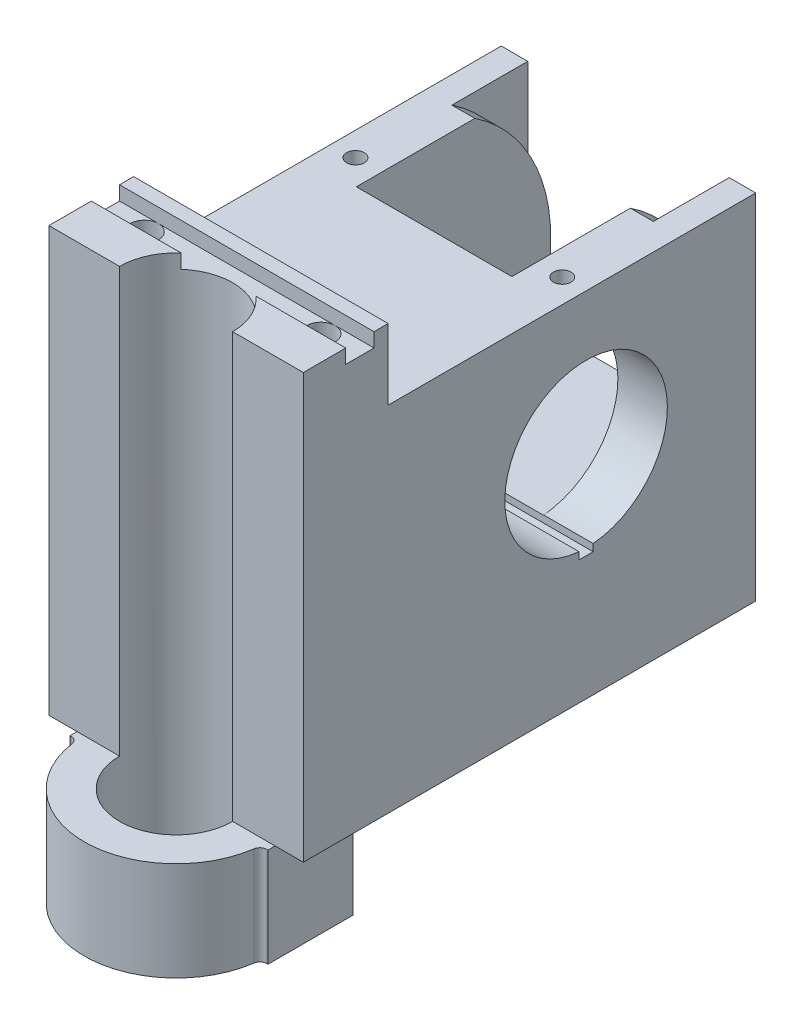
from build123d import *

# Parameters (mm, degrees)
BOSS_EXTRUDE2_DEPTH     = 69.85
BOSS_EXTRUDE3_START     = 69.85
BOSS_EXTRUDE3_DEPTH     = 20.6375
BOSS_EXTRUDE4_START     = 90.4875
BOSS_EXTRUDE4_DEPTH     = 23.8125
BOSS_EXTRUDE5_START     = 69.85
BOSS_EXTRUDE5_DEPTH     = 19.05
SKETCH2_R               = 50.8
CUT_EXTRUDE1_DEPTH      = 632.689369865
SKETCH3_R               = 12.7
CUT_EXTRUDE2_DEPTH      = 38.1
CUT_EXTRUDE3_REACH      = 587.992
CUT_EXTRUDE3_END_RADIUS = 73.025
SKETCH4_R               = 7.9375


# Read off the part's stored shape, not the designer's step: Boss-Extrude4
with BuildPart() as part:
    # Sketch1 → Boss-Extrude2 (new body)
    with BuildSketch(Plane(origin=(0, 0, 0), x_dir=(0, 0, -1), z_dir=(1, 0, 0))):
        with BuildLine():
            Line((0, 381), (0, 0))
            Line((0, 0), (-82.55, 0))
            Line((-82.55, 0), (-82.55, -88.9))
            Line((-82.55, -88.9), (69.85, -88.9))
            Line((69.85, -88.9), (69.85, 0))
            Line((69.85, 0), (406.4, 0))
            Line((406.4, 0), (406.4, 117.475))
            Line((406.4, 117.475), (260.35, 117.475))
            Line((260.35, 117.475), (260.35, 111.401610843))
            Line((260.35, 111.401610843), (247.65, 111.401610843))
            Line((247.65, 111.401610843), (247.65, 117.751610843))
            ThreePointArc((247.65, 117.751610843), (181.425166335, 182.404066236), (231.775, 260.060764803))
            Line((231.775, 260.060764803), (231.775, 317.5))
            Line((231.775, 317.5), (76.2, 317.5))
            Line((76.2, 317.5), (76.2, 381))
            Line((76.2, 381), (63.5, 381))
            Line((63.5, 381), (63.5, 368.3))
            Line((63.5, 368.3), (38.1, 368.3))
            Line((38.1, 368.3), (38.1, 381))
            Line((38.1, 381), (0, 381))
        make_face()
    boss_extrude2 = extrude(amount=BOSS_EXTRUDE2_DEPTH)

    # Sketch1<4> → Boss-Extrude3 (add)
    with BuildSketch(Plane(origin=(0, 0, 0), x_dir=(0, 0, -1), z_dir=(1, 0, 0)).offset(BOSS_EXTRUDE3_START)):
        with BuildLine():
            Line((0, 381), (0, 0))
            Line((0, 0), (406.4, 0))
            Line((406.4, 0), (406.4, 190.5))
            ThreePointArc((406.4, 190.5), (388.283807472, 262.566768006), (338.242269675, 317.5))
            Line((338.242269675, 317.5), (76.2, 317.5))
            Line((76.2, 317.5), (76.2, 381))
            Line((76.2, 381), (63.5, 381))
            Line((63.5, 381), (63.5, 368.3))
            Line((63.5, 368.3), (38.1, 368.3))
            Line((38.1, 368.3), (38.1, 381))
            Line((38.1, 381), (0, 381))
        make_face()
        with BuildLine():
            Line((260.35, 117.751610843), (260.35, 111.401610843))
            Line((260.35, 111.401610843), (247.65, 111.401610843))
            Line((247.65, 111.401610843), (247.65, 117.751610843))
            ThreePointArc((247.65, 117.751610843), (254, 263.525), (260.35, 117.751610843))
        make_face(mode=Mode.SUBTRACT)
    boss_extrude3 = extrude(amount=BOSS_EXTRUDE3_DEPTH)

    # Boss-Extrude4 outline → Boss-Extrude4 (add)
    with BuildSketch(Plane(origin=(0, 0, 0), x_dir=(0, 0, -1), z_dir=(1, 0, 0)).offset(BOSS_EXTRUDE4_START)):
        Polygon((406.4, 317.5), (76.2, 317.5), (76.2, 381), (63.5, 381), (63.5, 368.3), (38.1, 368.3), (38.1, 381), (0, 381), (0, 0), (406.4, 0), align=None)
        with BuildLine():
            Line((247.65, 111.401610843), (247.65, 117.751610843))
            ThreePointArc((247.65, 117.751610843), (254, 263.525), (260.35, 117.751610843))
            Line((260.35, 117.751610843), (260.35, 111.401610843))
            Line((260.35, 111.401610843), (247.65, 111.401610843))
        make_face(mode=Mode.SUBTRACT)
    boss_extrude4 = extrude(amount=BOSS_EXTRUDE4_DEPTH)

    # Sketch1<6> → Boss-Extrude5 (add)
    with BuildSketch(Plane(origin=(0, 0, 0), x_dir=(0, 0, -1), z_dir=(1, 0, 0)).offset(BOSS_EXTRUDE5_START)):
        Polygon((69.85, 0), (0, 0), (-82.55, 0), (-82.55, -88.9), (69.85, -88.9), align=None)
    boss_extrude5 = extrude(amount=BOSS_EXTRUDE5_DEPTH)

    # Mirror2: Boss-Extrude2, Boss-Extrude3, Boss-Extrude4, Boss-Extrude5 across plane
    add(boss_extrude2.mirror(Plane(origin=(0, 0, 0), x_dir=(0, 0, 1), z_dir=(1, 0, 0))))
    add(boss_extrude3.mirror(Plane(origin=(0, 0, 0), x_dir=(0, 0, 1), z_dir=(1, 0, 0))))
    add(boss_extrude4.mirror(Plane(origin=(0, 0, 0), x_dir=(0, 0, 1), z_dir=(1, 0, 0))))
    add(boss_extrude5.mirror(Plane(origin=(0, 0, 0), x_dir=(0, 0, 1), z_dir=(1, 0, 0))))

    # Sketch2 → Cut-Extrude1 (cut, through all)
    with BuildSketch(Plane(origin=(0, 381, 0), x_dir=(1, 0, 0), z_dir=(0, 1, 0))):
        with Locations(Location((0, 0, 0), (0, 0, 270))):
            Circle(SKETCH2_R)
        with BuildLine():
            Line((-88.9, -88.9), (88.9, -88.9))
            Line((88.9, -88.9), (88.9, -6.35))
            Line((88.9, -6.35), (87.988181024, -6.35))
            ThreePointArc((87.988181024, -6.35), (83.831130216, -7.899851193), (81.703310951, -11.792857143))
            ThreePointArc((81.703310951, -11.792857143), (0, -82.55), (-81.703310951, -11.792857143))
            ThreePointArc((-81.703310951, -11.792857143), (-83.831130216, -7.899851193), (-87.988181024, -6.35))
            Line((-87.988181024, -6.35), (-88.9, -6.35))
            Line((-88.9, -6.35), (-88.9, -88.9))
        make_face()
    extrude(amount=-CUT_EXTRUDE1_DEPTH, mode=Mode.SUBTRACT)

    # Sketch3 → Cut-Extrude2 (cut)
    with BuildSketch(Plane(origin=(0, 368.3, 0), x_dir=(1, 0, 0), z_dir=(0, 1, 0))):
        with Locations(Location((-79.375, 50.8, 0), (0, 0, 270))):
            Circle(SKETCH3_R)
        with Locations(Location((79.375, 50.8, 0), (0, 0, 270))):
            Circle(SKETCH3_R)
    extrude(amount=-CUT_EXTRUDE2_DEPTH, mode=Mode.SUBTRACT)

    # Cut-Extrude3: up to this cylinder (the profile starts outside it)
    cut_extrude3_end = Plane(origin=(0, 190.5, -254), z_dir=(-1, 0, 0)) * Cylinder(CUT_EXTRUDE3_END_RADIUS, 1508.7715, mode=Mode.PRIVATE)
    # Sketch4 → Cut-Extrude3 (cut, up to the surface)
    with BuildSketch(Plane(origin=(0, 317.5, 0), x_dir=(1, 0, 0), z_dir=(0, 1, 0)), mode=Mode.PRIVATE) as cut_extrude3_sk1:
        with Locations(Location((-92.86875, 254, 0), (0, 0, 270))):
            Circle(SKETCH4_R)
    cut_extrude3_tool1 = extrude(cut_extrude3_sk1.sketch, amount=-CUT_EXTRUDE3_REACH, mode=Mode.PRIVATE) - cut_extrude3_end
    add(cut_extrude3_tool1.solids().sort_by_distance((-92.86875, 317.5, -254))[0], mode=Mode.SUBTRACT)
    # Sketch4 → Cut-Extrude3 (cut, up to the surface)
    with BuildSketch(Plane(origin=(0, 317.5, 0), x_dir=(1, 0, 0), z_dir=(0, 1, 0)), mode=Mode.PRIVATE) as cut_extrude3_sk2:
        with Locations(Location((92.86875, 254, 0), (0, 0, 270))):
            Circle(SKETCH4_R)
    cut_extrude3_tool2 = extrude(cut_extrude3_sk2.sketch, amount=-CUT_EXTRUDE3_REACH, mode=Mode.PRIVATE) - cut_extrude3_end
    add(cut_extrude3_tool2.solids().sort_by_distance((92.86875, 317.5, -254))[0], mode=Mode.SUBTRACT)


solid = part.part
